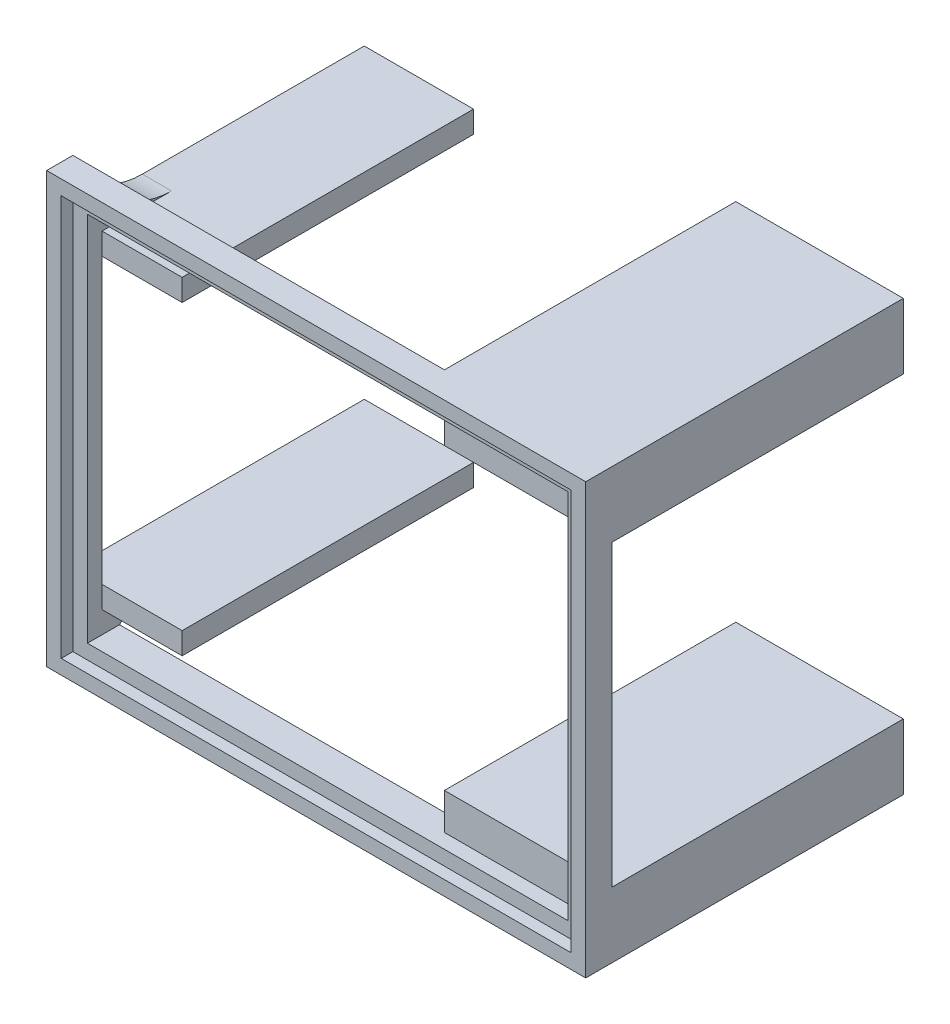
from build123d import *

# Parameters (mm, degrees)
SKETCH1_W                = 70
SKETCH1_H                = 55
SKETCH1_W_2              = 66
SKETCH1_H_2              = 51
BOSS_EXTRUDE1_DEPTH      = 2
BOSS_EXTRUDE2_DEPTH      = 1.6
BOSS_EXTRUDE2_DEPTH_BACK = 2
SKETCH2_W                = 74
SKETCH2_H                = 59
SKETCH2_W_2              = 70
SKETCH2_H_2              = 55
SKETCH3_W                = 23
SKETCH3_H                = 9
SKETCH3_W_2              = 15
SKETCH3_H_2              = 3
BOSS_EXTRUDE3_DEPTH      = 40
FILLET1_START            = -37
FILLET1_DEPTH            = 70
FILLET1_2_DEPTH          = 4


with BuildPart() as part:
    # Sketch1 → Boss-Extrude1 (new body)
    with BuildSketch(Plane.XY):
        Rectangle(SKETCH1_W, SKETCH1_H)
        Rectangle(SKETCH1_W_2, SKETCH1_H_2, mode=Mode.SUBTRACT)
    extrude(amount=BOSS_EXTRUDE1_DEPTH)

    # Sketch2 → Boss-Extrude2 (add, two sides: drawn at the far end of the back side and taken through both)
    with BuildSketch(Plane.XY.offset(2).offset(-BOSS_EXTRUDE2_DEPTH_BACK)):
        Rectangle(SKETCH2_W, SKETCH2_H)
        Rectangle(SKETCH2_W_2, SKETCH2_H_2, mode=Mode.SUBTRACT)
    extrude(amount=BOSS_EXTRUDE2_DEPTH + BOSS_EXTRUDE2_DEPTH_BACK)

    # Sketch3 → Boss-Extrude3 (add)
    with BuildSketch(Plane(origin=(0, 0, 0), x_dir=(-1, 0, 0), z_dir=(0, 0, -1))):
        with Locations((-25.5, 25)):
            Rectangle(SKETCH3_W, SKETCH3_H)
        with Locations((-25.5, -25)):
            Rectangle(SKETCH3_W, SKETCH3_H)
        with Locations((29.5, 21)):
            Rectangle(SKETCH3_W_2, SKETCH3_H_2)
        with Locations((29.5, -21)):
            Rectangle(SKETCH3_W_2, SKETCH3_H_2)
    extrude(amount=BOSS_EXTRUDE3_DEPTH)

    # Fillet1: read off the stored shape, not the designer's step
    # Fillet1 outline → Fillet1 (add)
    with BuildSketch(Plane.YZ.offset(FILLET1_START)):
        with BuildLine():
            Line((29.5, 0), (25.5, 0))
            Line((25.5, 0), (25.5, -2.397963586))
            ThreePointArc((25.5, -2.397963586), (27.358253474, -0.962536958), (29.5, 0))
        make_face()
        with BuildLine():
            ThreePointArc((-29.5, 0), (-27.358253474, -0.962536958), (-25.5, -2.397963586))
            Line((-25.5, -2.397963586), (-25.5, 0))
            Line((-25.5, 0), (-29.5, 0))
        make_face()
    extrude(amount=FILLET1_DEPTH)

    # Fillet1 2 outline → Fillet1 2 (add)
    with BuildSketch(Plane.YZ.offset(FILLET1_START)):
        with BuildLine():
            Line((25.5, -2.397963586), (25.5, 0))
            Line((25.5, 0), (22.5, 0))
            Line((22.5, 0), (22.5, -9.539392014))
            ThreePointArc((22.5, -9.539392014), (23.280455543, -5.666408668), (25.5, -2.397963586))
        make_face()
        with BuildLine():
            Line((-25.5, 0), (-25.5, -2.397963586))
            ThreePointArc((-25.5, -2.397963586), (-23.280455543, -5.666408668), (-22.5, -9.539392014))
            Line((-22.5, -9.539392014), (-22.5, 0))
            Line((-22.5, 0), (-25.5, 0))
        make_face()
    extrude(amount=FILLET1_2_DEPTH)


solid = part.part
